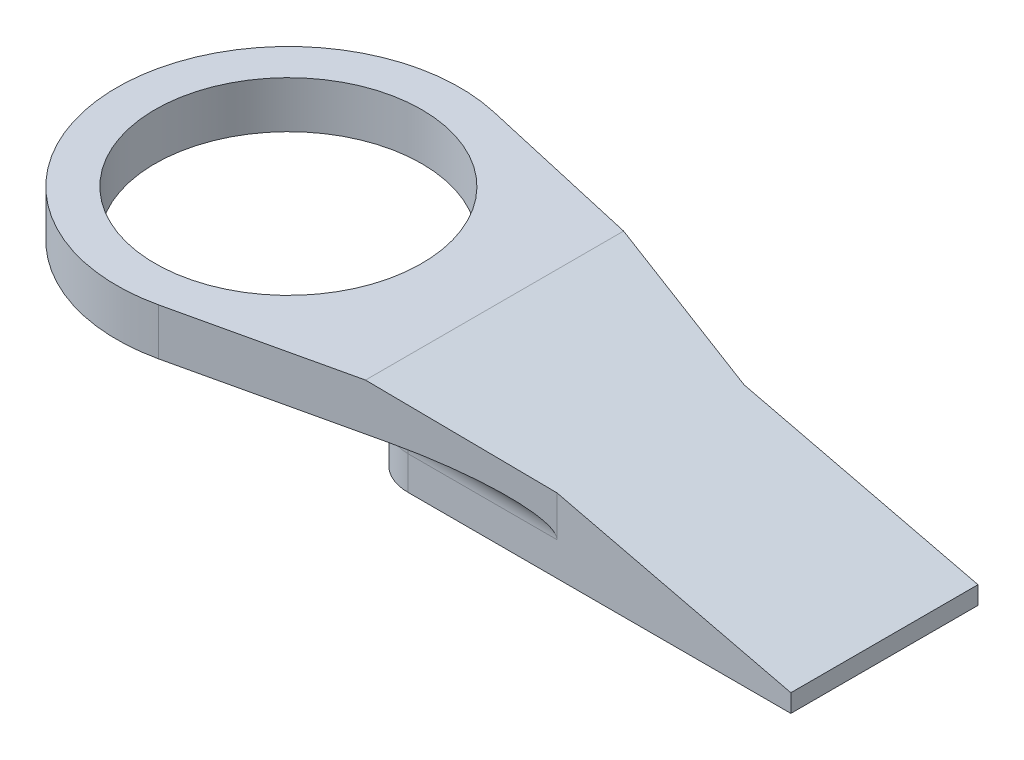
from build123d import *

# Parameters (mm, degrees)
SKETCH1_W           = 30
SKETCH1_H           = 7.15
BOSS_EXTRUDE1_DEPTH = 12
BOSS_EXTRUDE2_DEPTH = 3
SKETCH3_R           = 11
CUT_EXTRUDE1_DEPTH  = 21
FILLET1_R           = 3
SKETCH4_R           = 8.55
CUT_EXTRUDE2_DEPTH  = 10
CHAMFER1_SIZE       = 6
CHAMFER1_SIZE2      = 25
SKETCH5_W           = 1.256127395
SKETCH5_H           = 6
BOSS_EXTRUDE3_DEPTH = 5
FILLET2_R           = 2


with BuildPart() as part:
    # Sketch1 → Boss-Extrude1 (new body)
    with BuildSketch(Plane.XY):
        with Locations((15, 3.575)):
            Rectangle(SKETCH1_W, SKETCH1_H)
    extrude(amount=BOSS_EXTRUDE1_DEPTH)

    # Sketch2 → Boss-Extrude2 (add)
    with BuildSketch(Plane(origin=(0, 7.15, 0), x_dir=(1, 0, 0), z_dir=(0, 1, 0))):
        with BuildLine():
            Line((-5.740463467, -16.717223807), (15, -12))
            Line((15, -12), (0, -12))
            Line((0, -12), (0, 0))
            Line((0, 0), (15, 0))
            Line((15, 0), (-5.780447832, 4.726396473))
            ThreePointArc((-5.780447832, 4.726396473), (-19.220429084, -5.979448936), (-5.820543341, -16.735437223))
            Line((-5.820543341, -16.735437223), (-5.740463467, -16.717223807))
        make_face()
    extrude(amount=-BOSS_EXTRUDE2_DEPTH)

    # Sketch3 → Cut-Extrude1 (cut)
    with BuildSketch(Plane.XZ.offset(-4.15)):
        with Locations((-8.220106634, 6)):
            Circle(SKETCH3_R)
    extrude(amount=CUT_EXTRUDE1_DEPTH, mode=Mode.SUBTRACT)

    # Fillet1
    fillet1_edges = [part.edges().sort_by_distance(p)[0] for p in [
        (0.999437824, 2.075, 0),
        (0.999437824, 2.075, 12),
    ]]
    fillet(fillet1_edges, radius=FILLET1_R)

    # Sketch4 → Cut-Extrude2 (cut)
    with BuildSketch(Plane.XZ.offset(-4.15)):
        with Locations((-8.220106634, 6)):
            Circle(SKETCH4_R)
    extrude(amount=-CUT_EXTRUDE2_DEPTH, mode=Mode.SUBTRACT)

    # Chamfer1
    chamfer1_edges = [part.edges().sort_by_distance(p)[0] for p in [
        (30, 7.15, 6),
    ]]
    chamfer1_side = [part.faces().sort_by_distance(p)[0] for p in [
        (30, 3.575, 6),
    ]]
    chamfer(chamfer1_edges, length=CHAMFER1_SIZE, length2=CHAMFER1_SIZE2, reference=chamfer1_side[0])

    # Sketch5 → Boss-Extrude3 (add)
    with BuildSketch(Plane(origin=(0, 0, 0), x_dir=(-1, 0, 0), z_dir=(0, -1, 0))):
        with Locations((-3.082751396, -6)):
            Rectangle(SKETCH5_W, SKETCH5_H)
    extrude(amount=-BOSS_EXTRUDE3_DEPTH)

    # Fillet2
    fillet2_edges = [part.edges().sort_by_distance(p)[0] for p in [
        (10.227343849, 4.15, 0),
        (10.227343849, 4.15, 12),
        (3.333367354, 4.15, 11.121320344),
        (2.454687698, 4.15, 6),
        (3.333367354, 4.15, 0.878679656),
    ]]
    fillet(fillet2_edges, radius=FILLET2_R)


solid = part.part
